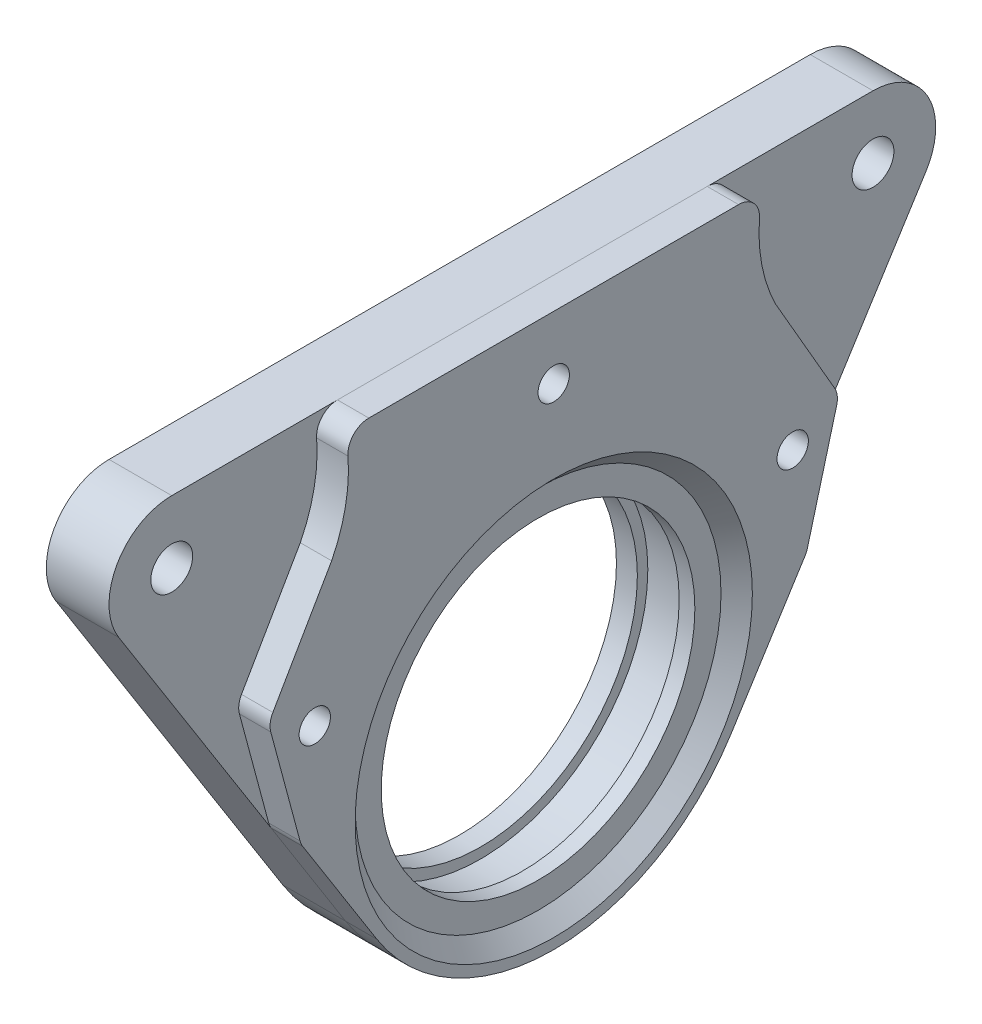
from build123d import *
from OCP.BRepFilletAPI import BRepFilletAPI_MakeChamfer

# Parameters (mm, degrees)
SKETCH1_R           = 20
SKETCH1_R_2         = 15
BOSS_EXTRUDE1_DEPTH = 2
SKETCH2_R           = 20
SKETCH2_R_2         = 16
BOSS_EXTRUDE2_DEPTH = 4
BOSS_EXTRUDE3_START = -6
SKETCH3_R           = 2
BOSS_EXTRUDE3_DEPTH = 6
SKETCH4_R           = 2.4
CUT_EXTRUDE1_DEPTH  = 6
SKETCH5_R           = 15
SKETCH5_R_2         = 1.5
BOSS_EXTRUDE4_DEPTH = 3
FILLET1_R           = 2
CUT_EXTRUDE2_START  = -1.5
SKETCH6_R           = 17.5
SKETCH6_R_2         = 15
CUT_EXTRUDE2_DEPTH  = 1.5
CHAMFER1_SIZE       = 1.5
CHAMFER2_START      = 6
CHAMFER2_DEPTH      = 3
CHAMFER2_2_DEPTH    = 3
CHAMFER3_SIZE       = 4
CHAMFER3_SIZE2      = 9.534572009
FILLET2_R           = 2


with BuildPart() as part:
    # Sketch1 → Boss-Extrude1 (new body)
    with BuildSketch(Plane(origin=(0, 0, 0), x_dir=(0, 0, -1), z_dir=(1, 0, 0))):
        Circle(SKETCH1_R)
        Circle(SKETCH1_R_2, mode=Mode.SUBTRACT)
    extrude(amount=BOSS_EXTRUDE1_DEPTH)

    # Sketch2 → Boss-Extrude2 (add)
    with BuildSketch(Plane(origin=(2, 0, 0), x_dir=(0, 0, -1), z_dir=(1, 0, 0))):
        Circle(SKETCH2_R)
        Circle(SKETCH2_R_2, mode=Mode.SUBTRACT)
    extrude(amount=BOSS_EXTRUDE2_DEPTH)

    # Sketch3 → Boss-Extrude3 (add)
    with BuildSketch(Plane(origin=(6, 0, 0), x_dir=(0, 0, -1), z_dir=(1, 0, 0)).offset(BOSS_EXTRUDE3_START)):
        with BuildLine():
            Line((-38.608830959, 23.677807584), (-16.909895057, -10.679674581))
            ThreePointArc((-16.909895057, -10.679674581), (0, 20), (16.909895057, -10.679674581))
            Line((16.909895057, -10.679674581), (38.608830959, 23.677807584))
            ThreePointArc((38.608830959, 23.677807584), (38.790546744, 29.777964933), (33.535862442, 32.881709959))
            Line((33.535862442, 32.881709959), (-33.535862442, 32.881709959))
            ThreePointArc((-33.535862442, 32.881709959), (-38.790546744, 29.777964933), (-38.608830959, 23.677807584))
        make_face()
        with Locations((-33.535862442, 26.881709959)):
            Circle(SKETCH3_R, mode=Mode.SUBTRACT)
        with Locations((33.535862442, 26.881709959)):
            Circle(SKETCH3_R, mode=Mode.SUBTRACT)
    extrude(amount=BOSS_EXTRUDE3_DEPTH)

    # Sketch4 → Cut-Extrude1 (cut)
    with BuildSketch(Plane(origin=(6, 0, 0), x_dir=(0, 0, -1), z_dir=(1, 0, 0))):
        with Locations((-22.856187861, 9.971814902)):
            Circle(SKETCH4_R)
        with Locations((22.856187861, 9.971814902)):
            Circle(SKETCH4_R)
        with Locations((0, 26.881709959)):
            Circle(SKETCH4_R)
    extrude(amount=-CUT_EXTRUDE1_DEPTH, mode=Mode.SUBTRACT)


with BuildPart() as body_2:
    # Sketch5 → Boss-Extrude4 (new body)
    with BuildSketch(Plane(origin=(6, 0, 0), x_dir=(0, 0, -1), z_dir=(1, 0, 0))):
        with BuildLine():
            Line((16.909895057, -10.679674581), (32.929406929, 14.685168005))
            ThreePointArc((32.929406929, 14.685168005), (22.406301367, 20.899773925), (20, 32.881709959))
            Line((20, 32.881709959), (-20, 32.881709959))
            ThreePointArc((-20, 32.881709959), (-22.406301367, 20.899773925), (-32.929406929, 14.685168005))
            Line((-32.929406929, 14.685168005), (-16.909895057, -10.679674581))
            ThreePointArc((-16.909895057, -10.679674581), (0, -20), (16.909895057, -10.679674581))
        make_face()
        Circle(SKETCH5_R, mode=Mode.SUBTRACT)
        with Locations((-22.856187861, 9.971814902)):
            Circle(SKETCH5_R_2, mode=Mode.SUBTRACT)
        with Locations((0, 26.881709959)):
            Circle(SKETCH5_R_2, mode=Mode.SUBTRACT)
        with Locations((22.856187861, 9.971814902)):
            Circle(SKETCH5_R_2, mode=Mode.SUBTRACT)
    extrude(amount=BOSS_EXTRUDE4_DEPTH)

    # Fillet1
    fillet1_edges = [body_2.edges().sort_by_distance(p)[0] for p in [
        (7.5, 32.881709959, 20),
        (7.5, 32.881709959, -20),
    ]]
    fillet(fillet1_edges, radius=FILLET1_R)

    # Sketch6 → Cut-Extrude2 (cut)
    with BuildSketch(Plane(origin=(9, 0, 0), x_dir=(0, 0, -1), z_dir=(1, 0, 0)).offset(CUT_EXTRUDE2_START)):
        Circle(SKETCH6_R)
        Circle(SKETCH6_R_2, mode=Mode.SUBTRACT)
    extrude(amount=CUT_EXTRUDE2_DEPTH, mode=Mode.SUBTRACT)

    # Chamfer1
    chamfer1_edges = [body_2.edges().sort_by_distance(p)[0] for p in [
        (9, 0, 17.5),
    ]]
    chamfer(chamfer1_edges, length=CHAMFER1_SIZE - 0.0001)  # a hair under: the kernel refuses the full size

    # Chamfer2: read off the stored shape, not the designer's step
    # Chamfer2 outline → Chamfer2 (cut)
    with BuildSketch(Plane.YZ.offset(CHAMFER2_START)):
        with BuildLine():
            ThreePointArc((14.685168005, -32.929406929), (16.820809532, -26.759995627), (21.374989761, -22.082171028))
            Line((21.374989761, -22.082171028), (8.902916658, -29.277547321))
            Line((8.902916658, -29.277547321), (14.685168005, -32.929406929))
        make_face()
        with BuildLine():
            Line((14.685168005, 32.929406929), (8.902916658, 29.277547321))
            Line((8.902916658, 29.277547321), (21.374989761, 22.082171028))
            ThreePointArc((21.374989761, 22.082171028), (16.820809532, 26.759995627), (14.685168005, 32.929406929))
        make_face()
    extrude(amount=CHAMFER2_DEPTH, mode=Mode.SUBTRACT)

    # Chamfer2 2 outline → Chamfer2 2 (add)
    with BuildSketch(Plane.YZ.offset(CHAMFER2_START)):
        with BuildLine():
            Line((21.374989761, -22.082171028), (22.833050026, -21.240988317))
            ThreePointArc((22.833050026, -21.240988317), (22.09221084, -21.641110503), (21.374989761, -22.082171028))
        make_face()
        with BuildLine():
            Line((22.833050026, 21.240988317), (21.374989761, 22.082171028))
            ThreePointArc((21.374989761, 22.082171028), (22.09221084, 21.641110503), (22.833050026, 21.240988317))
        make_face()
    extrude(amount=CHAMFER2_2_DEPTH)

    # Chamfer3: one chamfer whose edges measure the first distance from different faces: ONE call of the kernel's chamfer builder (chamfer() names one face for all edges)
    chamfer3_edges_1 = [body_2.edges().sort_by_distance(p)[0] for p in [
        (7.5, 8.902916658, -29.277547321),
    ]]
    chamfer3_side_1 = [body_2.faces().sort_by_distance(p)[0] for p in [
        (7.5, 15.13895321, -25.679859174),
    ]]
    chamfer3_edges_2 = [body_2.edges().sort_by_distance(p)[0] for p in [
        (7.5, 8.902916658, 29.277547321),
    ]]
    chamfer3_side_2 = [body_2.faces().sort_by_distance(p)[0] for p in [
        (7.5, 15.138953209, 25.679859174),
    ]]
    chamfer3 = BRepFilletAPI_MakeChamfer(body_2.part.solid().wrapped)
    for e in chamfer3_edges_1:
        chamfer3.Add(CHAMFER3_SIZE, CHAMFER3_SIZE2, e.wrapped, chamfer3_side_1[0].wrapped)  # the first distance lies on this face
    for e in chamfer3_edges_2:
        chamfer3.Add(CHAMFER3_SIZE, CHAMFER3_SIZE2, e.wrapped, chamfer3_side_2[0].wrapped)  # the first distance lies on this face
    add(Compound.cast(chamfer3.Shape()), mode=Mode.REPLACE)

    # Fillet2
    fillet2_edges = [body_2.edges().sort_by_distance(p)[0] for p in [
        (7.5, 0.841486054, -24.186241005),
        (7.5, 12.367665074, -27.278668032),
        (7.5, 0.841486054, 24.186241005),
        (7.5, 12.367665074, 27.278668032),
    ]]
    fillet(fillet2_edges, radius=FILLET2_R)


solid = Compound([part.part, body_2.part])
